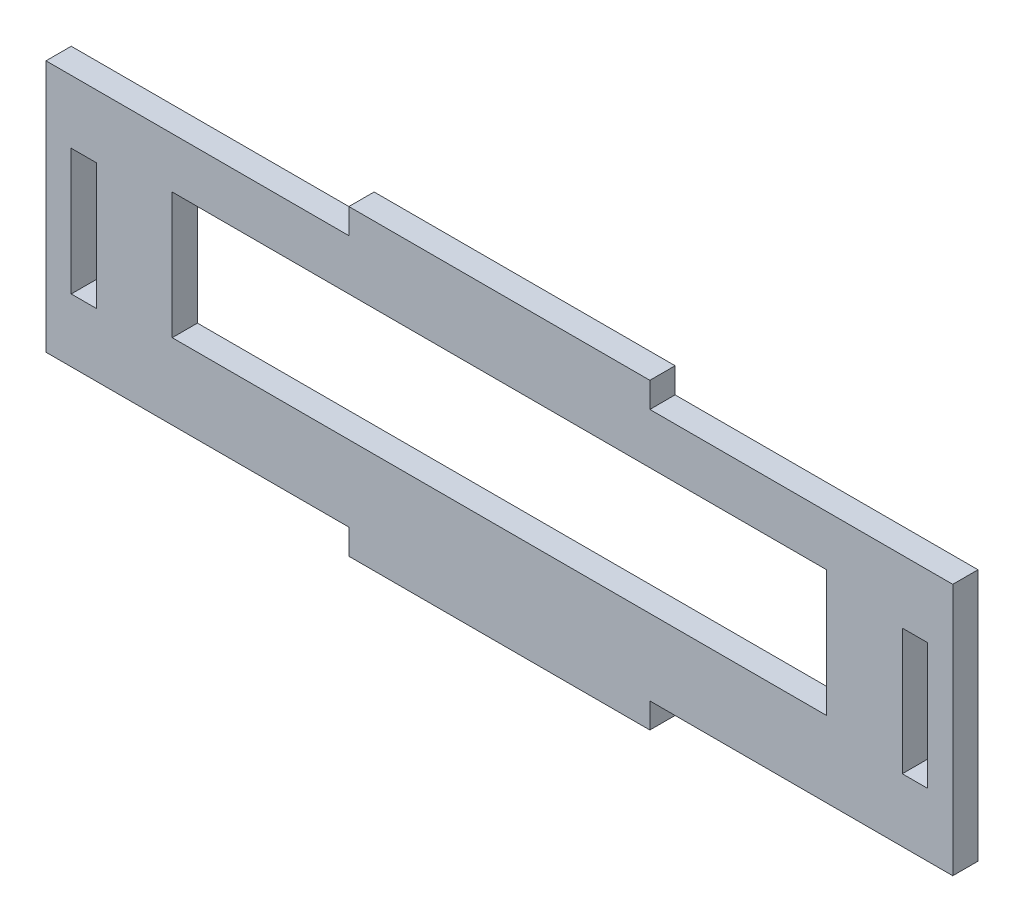
from build123d import *

# Parameters (mm, degrees)
SKETCH1_W           = 51.848
SKETCH1_H           = 10
SKETCH1_W_2         = 2
BOSS_EXTRUDE1_DEPTH = 2


with BuildPart() as part:
    # Sketch1 → Boss-Extrude1 (new body)
    with BuildSketch(Plane.XY):
        Polygon((0, 0), (24, 0), (24, -2), (47.848, -2), (47.848, 0), (71.848, 0), (71.848, 20), (47.848, 20), (47.848, 22), (24, 22), (24, 20), (0, 20), align=None)
        with Locations((35.924, 11)):
            Rectangle(SKETCH1_W, SKETCH1_H, mode=Mode.SUBTRACT)
        with Locations((3, 10)):
            Rectangle(SKETCH1_W_2, SKETCH1_H, mode=Mode.SUBTRACT)
        with Locations((68.848, 10)):
            Rectangle(SKETCH1_W_2, SKETCH1_H, mode=Mode.SUBTRACT)
    extrude(amount=BOSS_EXTRUDE1_DEPTH)


solid = part.part
